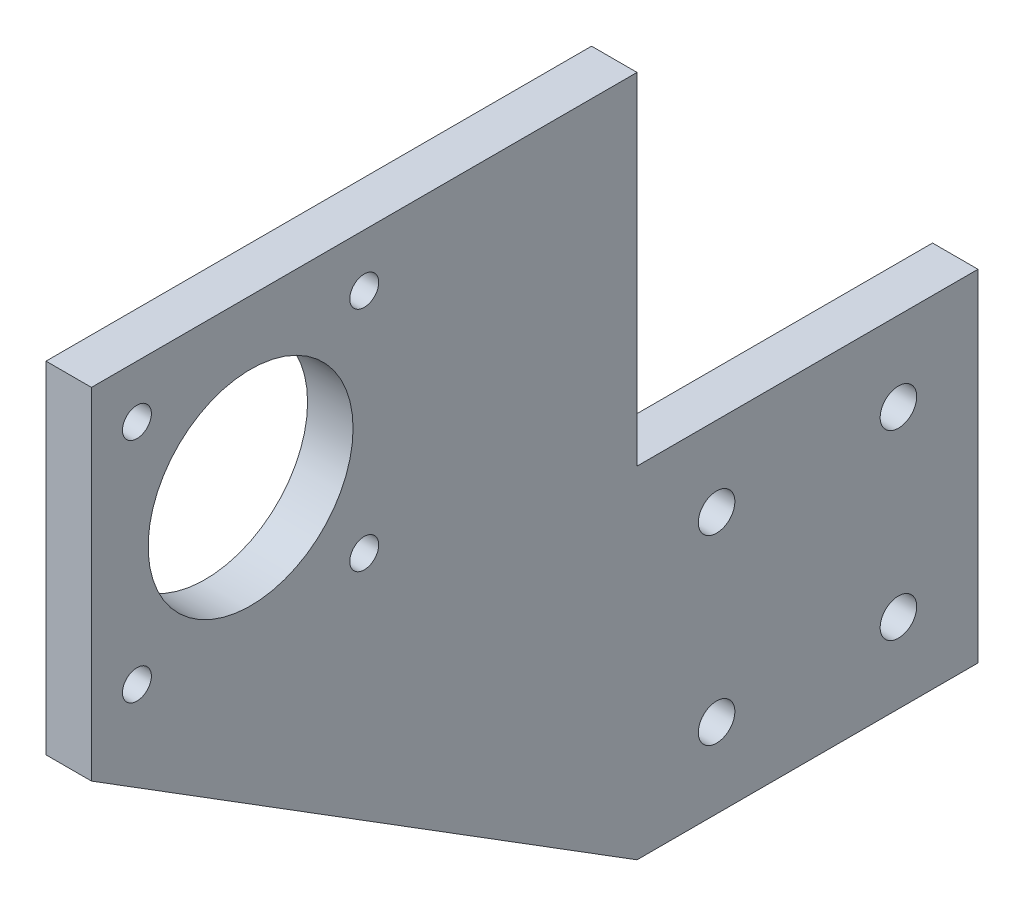
from build123d import *

# Parameters (mm, degrees)
BOSS_EXTRUDE1_DEPTH = 6.35
SKETCH2_R           = 2.5527
SKETCH2_R_2         = 14.3129
SKETCH2_R_3         = 2.0193
CUT_EXTRUDE1_DEPTH  = 91.08275709


with BuildPart() as part:
    # Sketch1 → Boss-Extrude1 (new body)
    with BuildSketch(Plane(origin=(0, 0, 0), x_dir=(0, 0, -1), z_dir=(1, 0, 0))):
        Polygon((0, 0), (47.625, 0), (47.625, -47.625), (0, -47.625), (-76.2, 0), (-76.2, 47.625), (0, 47.625), align=None)
    extrude(amount=BOSS_EXTRUDE1_DEPTH)

    # Sketch2 → Cut-Extrude1 (cut, through all)
    with BuildSketch(Plane(origin=(6.35, 0, 0), x_dir=(0, 0, -1), z_dir=(1, 0, 0))):
        with Locations((11.1125, -11.1125)):
            Circle(SKETCH2_R)
        with Locations((36.5125, -11.1125)):
            Circle(SKETCH2_R)
        with Locations((36.5125, -36.5125)):
            Circle(SKETCH2_R)
        with Locations((11.1125, -36.5125)):
            Circle(SKETCH2_R)
        with Locations((-53.975, 24.4)):
            Circle(SKETCH2_R_2)
        with Locations((-69.85, 40.275)):
            Circle(SKETCH2_R_3)
        with Locations((-38.1, 40.275)):
            Circle(SKETCH2_R_3)
        with Locations((-38.1, 8.525)):
            Circle(SKETCH2_R_3)
        with Locations((-69.85, 8.525)):
            Circle(SKETCH2_R_3)
    extrude(amount=-CUT_EXTRUDE1_DEPTH, mode=Mode.SUBTRACT)


solid = part.part
